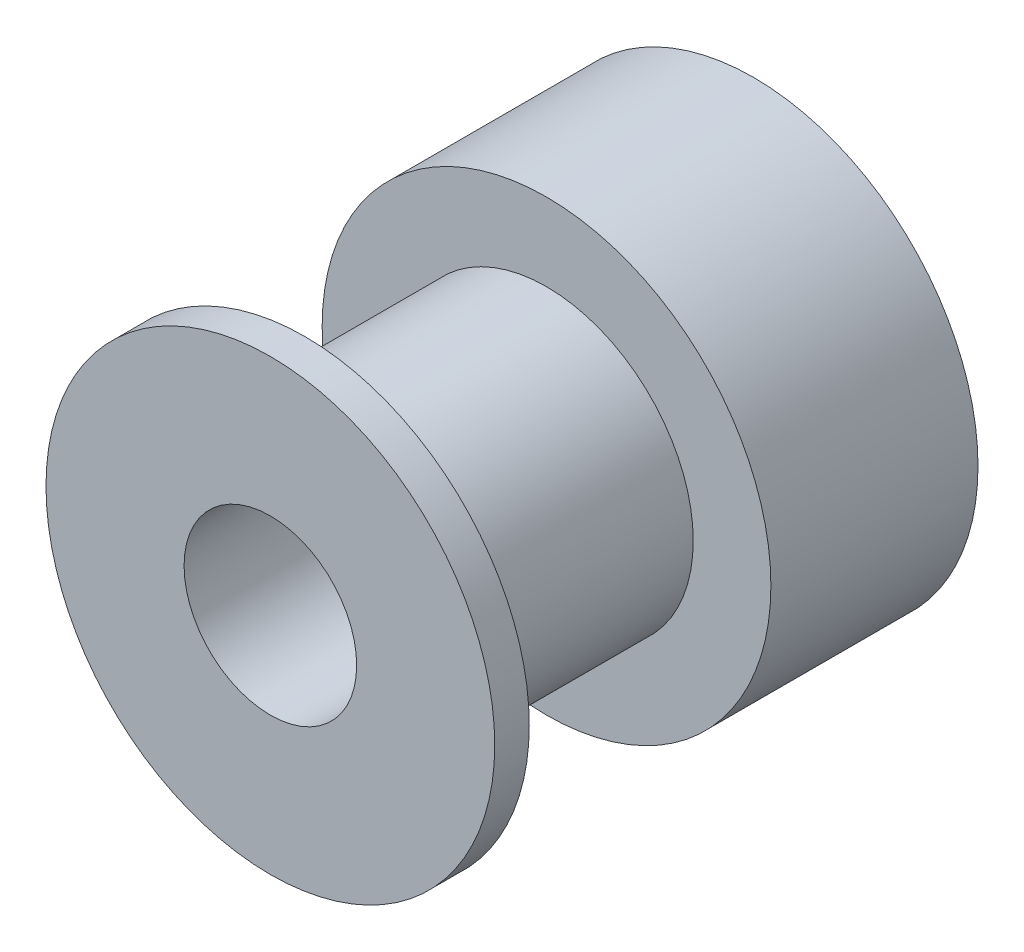
from build123d import *

# Parameters (mm, degrees)
SKETCH_1_R          = 6.5
EXTRUDE_1_DEPTH     = 6
SKETCH_2_R          = 4.25
EXTRUDE_2_DEPTH     = 7
SKETCH_3_R          = 6.5
EXTRUDE_3_DEPTH     = 1
SKETCH_4_R          = 2.5
CUT_EXTRUDE_1_DEPTH = 34
SKETCH_5_R          = 1.5
CUT_EXTRUDE_2_DEPTH = 10
SKETCH_6_R          = 1.5
CUT_EXTRUDE_3_DEPTH = 10


with BuildPart() as part:
    # 草图1 → 凸台-拉伸1 (new body)
    with BuildSketch(Plane.XY):
        Circle(SKETCH_1_R)
    extrude(amount=EXTRUDE_1_DEPTH)

    # 草图2 → 凸台-拉伸2 (add)
    with BuildSketch(Plane.XY.offset(6)):
        Circle(SKETCH_2_R)
    extrude(amount=EXTRUDE_2_DEPTH)

    # 草图3 → 凸台-拉伸3 (add)
    with BuildSketch(Plane.XY.offset(13)):
        Circle(SKETCH_3_R)
    extrude(amount=EXTRUDE_3_DEPTH)

    # 草图4 → 切除-拉伸1 (cut)
    with BuildSketch(Plane.XY.offset(14)):
        Circle(SKETCH_4_R)
    extrude(amount=-CUT_EXTRUDE_1_DEPTH, mode=Mode.SUBTRACT)

    # 草图5 → 切除-拉伸2 (cut)
    with BuildSketch(Plane(origin=(0, 0, 0), x_dir=(1, 0, 0), z_dir=(0, 1, 0))):
        with Locations((0, -3)):
            Circle(SKETCH_5_R)
    extrude(amount=-CUT_EXTRUDE_2_DEPTH, mode=Mode.SUBTRACT)

    # 草图6 → 切除-拉伸3 (cut)
    with BuildSketch(Plane(origin=(0, 0, 0), x_dir=(0, 0, -1), z_dir=(1, 0, 0))):
        with Locations((-3, 0)):
            Circle(SKETCH_6_R)
    extrude(amount=-CUT_EXTRUDE_3_DEPTH, mode=Mode.SUBTRACT)


solid = part.part
